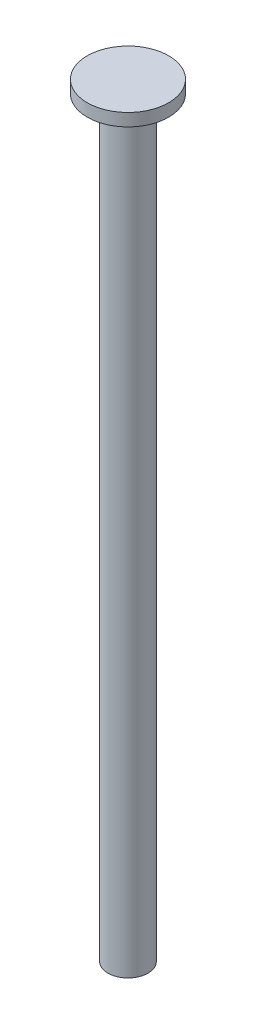
from build123d import *

# Parameters (mm, degrees)
SKETCH1_R           = 3.25
BOSS_EXTRUDE1_DEPTH = 1
SKETCH2_R           = 1.6
BOSS_EXTRUDE2_DEPTH = 60


with BuildPart() as part:
    # Sketch1 → Boss-Extrude1 (new body)
    with BuildSketch(Plane(origin=(0, 0, 0), x_dir=(1, 0, 0), z_dir=(0, 1, 0))):
        Circle(SKETCH1_R)
    extrude(amount=BOSS_EXTRUDE1_DEPTH)

    # Sketch2 → Boss-Extrude2 (add)
    with BuildSketch(Plane(origin=(0, 0, 0), x_dir=(1, 0, 0), z_dir=(0, 1, 0))):
        Circle(SKETCH2_R)
    extrude(amount=-BOSS_EXTRUDE2_DEPTH)


solid = part.part
